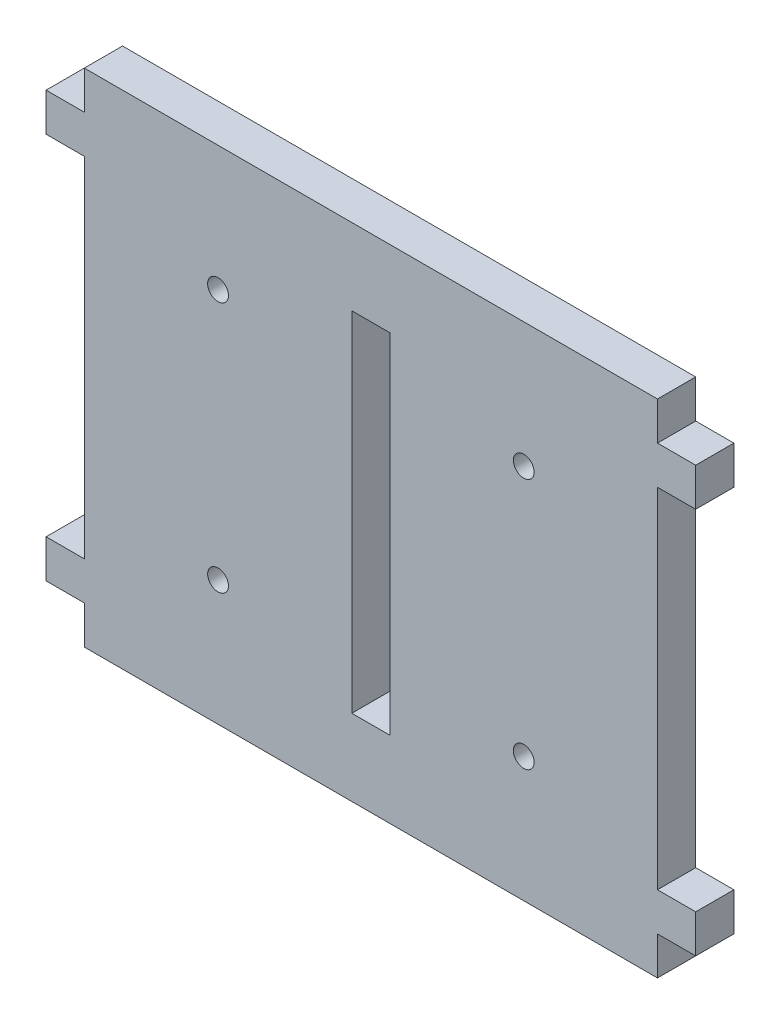
from build123d import *

# Parameters (mm, degrees)
SKETCH1_W                 = 6.35
SKETCH1_H                 = 57.927875
BOSS_EXTRUDE1_DEPTH       = 6.35
TAP_DRILL_FOR_8_32_TAP2_D = 3.4544


with BuildPart() as part:
    # Sketch1 → Boss-Extrude1 (new body)
    with BuildSketch(Plane.XY):
        Polygon((-101.6, 35.3139375), (-107.95, 35.3139375), (-107.95, 28.9639375), (-101.6, 28.9639375), (-101.6, -28.9639375), (-107.95, -28.9639375), (-107.95, -35.3139375), (-101.6, -35.3139375), (-101.6, -41.6639375), (-6.35, -41.6639375), (-6.35, -35.3139375), (0, -35.3139375), (0, -28.9639375), (-6.35, -28.9639375), (-6.35, 28.9639375), (0, 28.9639375), (0, 35.3139375), (-6.35, 35.3139375), (-6.35, 41.6639375), (-101.6, 41.6639375), align=None)
        with Locations((-53.975, 0)):
            Rectangle(SKETCH1_W, SKETCH1_H, mode=Mode.SUBTRACT)
    extrude(amount=BOSS_EXTRUDE1_DEPTH)

    # Tap Drill for #8-32 Tap2 (through all)
    with Locations(Plane(origin=(81.87086846, 75.287041891, -78.0748375), x_dir=(0, -1, 0), z_dir=(0, 0, -1))):
        with Locations((54.400304391, 110.44586846), (96.173779391, 110.44586846), (96.173779391, 161.24586846), (54.400304391, 161.24586846)):
            Hole(TAP_DRILL_FOR_8_32_TAP2_D / 2)


solid = part.part
